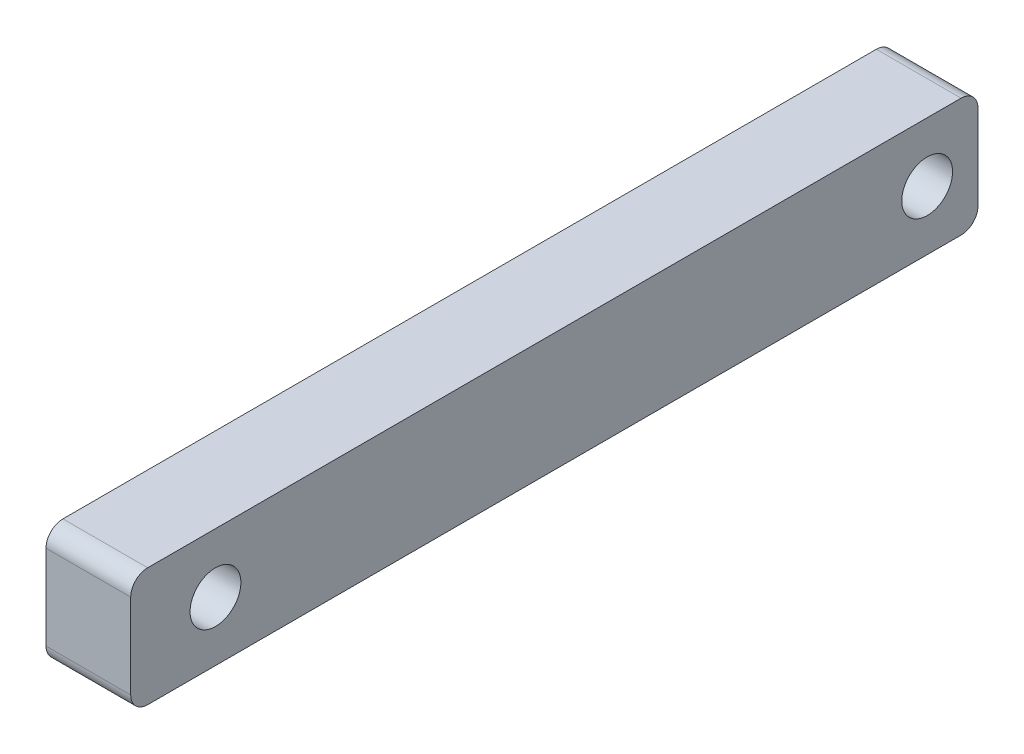
from build123d import *

# Parameters (mm, degrees)
SALIENTE_EXTRUIR1_DEPTH    = 2.5
CORTAR_EXTRUIR1_DEPTH      = 26.367301788
CORTAR_EXTRUIR1_DEPTH_BACK = 26.367301788
CROQUIS2_R                 = 1.5


with BuildPart() as part:
    # Croquis1 → Saliente-Extruir1 (new, symmetric)
    with BuildSketch(Plane(origin=(0, 0, 0), x_dir=(0, 0, -1), z_dir=(1, 0, 0))):
        with BuildLine():
            Line((-24, 3.5), (24, 3.5))
            ThreePointArc((24, 3.5), (24.707106781, 3.207106781), (25, 2.5))
            Line((25, 2.5), (25, -2.5))
            ThreePointArc((25, -2.5), (24.707106781, -3.207106781), (24, -3.5))
            Line((24, -3.5), (-24, -3.5))
            ThreePointArc((-24, -3.5), (-24.707106781, -3.207106781), (-25, -2.5))
            Line((-25, -2.5), (-25, 2.5))
            ThreePointArc((-25, 2.5), (-24.707106781, 3.207106781), (-24, 3.5))
        make_face()
    extrude(amount=SALIENTE_EXTRUIR1_DEPTH, both=True)

    # Croquis2 → Cortar-Extruir1 (cut, two sides: drawn at the far end of the back side and taken through both)
    with BuildSketch(Plane(origin=(0, 0, 0), x_dir=(0, 0, -1), z_dir=(1, 0, 0)).offset(-CORTAR_EXTRUIR1_DEPTH_BACK)):
        with Locations((-20, 0)):
            Circle(CROQUIS2_R)
        with Locations((22, 0)):
            Circle(CROQUIS2_R)
    extrude(amount=CORTAR_EXTRUIR1_DEPTH + CORTAR_EXTRUIR1_DEPTH_BACK, mode=Mode.SUBTRACT)


solid = part.part
